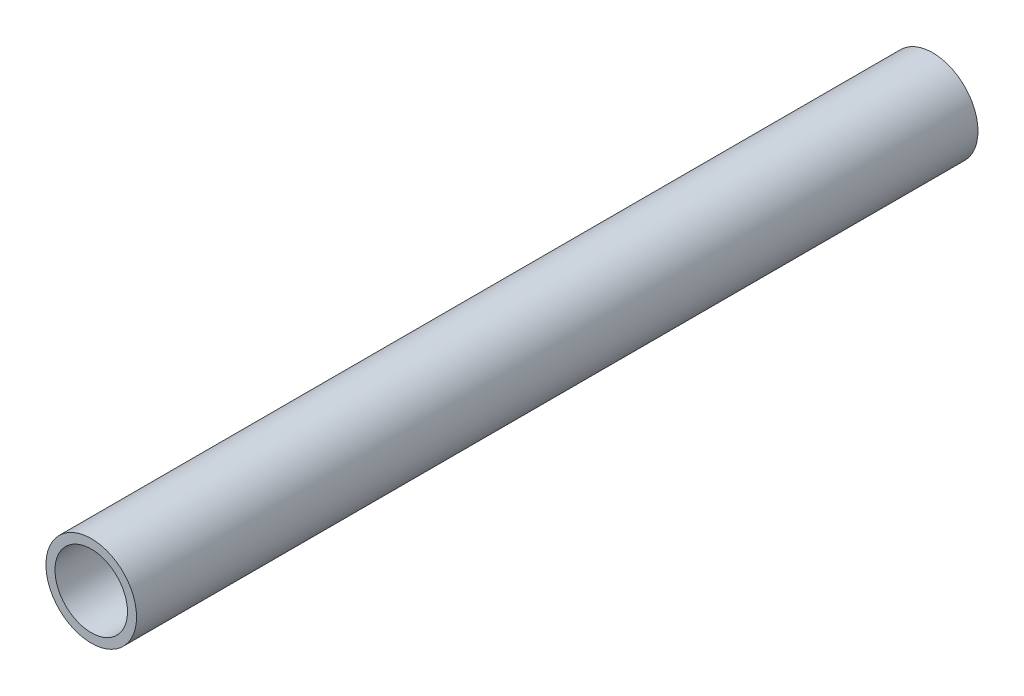
from build123d import *

# Parameters (mm, degrees)
SKETCH1_R           = 1.25
SKETCH1_R_2         = 1
BOSS_EXTRUDE1_DEPTH = 23.21


with BuildPart() as part:
    # Sketch1 → Boss-Extrude1 (new body)
    with BuildSketch(Plane.XY):
        Circle(SKETCH1_R)
        Circle(SKETCH1_R_2, mode=Mode.SUBTRACT)
    extrude(amount=BOSS_EXTRUDE1_DEPTH)


solid = part.part
